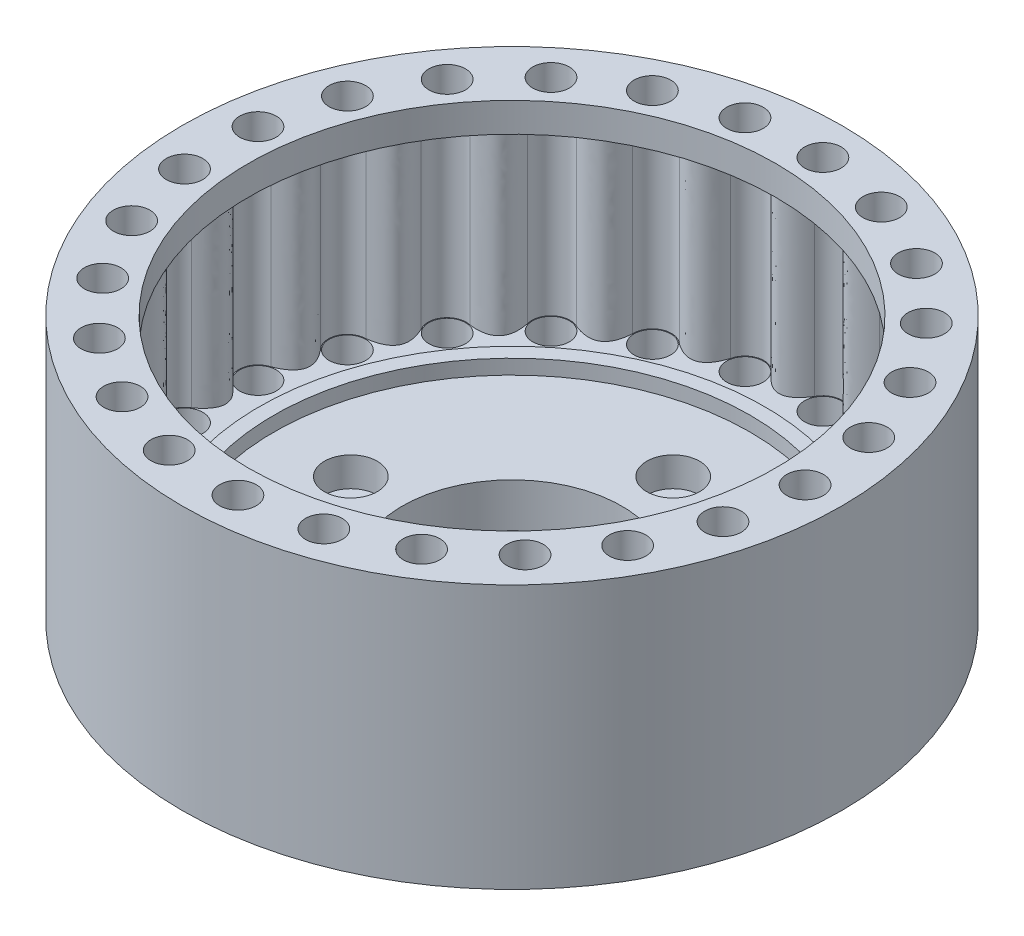
from build123d import *

# Parameters (mm, degrees)
SKETCH1_R           = 45
SKETCH1_R_2         = 2
BOSS_EXTRUDE1_DEPTH = 6
SKETCH2_R           = 3.61
CUT_EXTRUDE1_DEPTH  = 4
SKETCH4_R           = 15
CUT_EXTRUDE2_DEPTH  = 64.921827258
SKETCH5_R           = 2.5
CUT_EXTRUDE3_DEPTH  = 4
SKETCH6_R           = 34.5
SKETCH6_R_2         = 32.5
BOSS_EXTRUDE2_DEPTH = 2
SKETCH7_R           = 45
BOSS_EXTRUDE4_DEPTH = 30
BOSS_EXTRUDE5_START = -4
SKETCH8_R           = 45
SKETCH8_R_2         = 36
BOSS_EXTRUDE5_DEPTH = 4
SKETCH9_R           = 2.5
CUT_EXTRUDE4_DEPTH  = 4


with BuildPart() as part:
    # Sketch1 → Boss-Extrude1 (new body)
    with BuildSketch(Plane(origin=(0, 0, 0), x_dir=(1, 0, 0), z_dir=(0, 1, 0))):
        Circle(SKETCH1_R)
        with Locations((0, -22)):
            Circle(SKETCH1_R_2, mode=Mode.SUBTRACT)
        with Locations((-22, 0)):
            Circle(SKETCH1_R_2, mode=Mode.SUBTRACT)
        with Locations((0, 22)):
            Circle(SKETCH1_R_2, mode=Mode.SUBTRACT)
        with Locations((22, 0)):
            Circle(SKETCH1_R_2, mode=Mode.SUBTRACT)
    extrude(amount=BOSS_EXTRUDE1_DEPTH)

    # Sketch2 → Cut-Extrude1 (cut)
    with BuildSketch(Plane(origin=(0, 6, 0), x_dir=(1, 0, 0), z_dir=(0, 1, 0))):
        with Locations((0, 22)):
            Circle(SKETCH2_R)
        with Locations((22, 0)):
            Circle(SKETCH2_R)
        with Locations((0, -22)):
            Circle(SKETCH2_R)
        with Locations((-22, 0)):
            Circle(SKETCH2_R)
    extrude(amount=-CUT_EXTRUDE1_DEPTH, mode=Mode.SUBTRACT)

    # Sketch4 → Cut-Extrude2 (cut, through all)
    with BuildSketch(Plane(origin=(0, 6, 0), x_dir=(1, 0, 0), z_dir=(0, 1, 0))):
        Circle(SKETCH4_R)
    extrude(amount=-CUT_EXTRUDE2_DEPTH, mode=Mode.SUBTRACT)

    # Sketch5 → Cut-Extrude3 (cut)
    with BuildSketch(Plane(origin=(0, 6, 0), x_dir=(1, 0, 0), z_dir=(0, 1, 0))):
        with Locations((40, 0)):
            Circle(SKETCH5_R)
        with Locations((38.743326445, -9.947595487)):
            Circle(SKETCH5_R)
        with Locations((35.052267202, -19.270146964)):
            Circle(SKETCH5_R)
        with Locations((29.158745097, -27.381884237)):
            Circle(SKETCH5_R)
        with Locations((21.433071799, -33.77311702)):
            Circle(SKETCH5_R)
        with Locations((12.360679775, -38.042260652)):
            Circle(SKETCH5_R)
        with Locations((2.511620781, -39.921069137)):
            Circle(SKETCH5_R)
        with Locations((-7.495252583, -39.291490029)):
            Circle(SKETCH5_R)
        with Locations((-17.031171663, -36.193082099)):
            Circle(SKETCH5_R)
        with Locations((-25.49695959, -30.820529711)):
            Circle(SKETCH5_R)
        with Locations((-32.360679775, -23.511410092)):
            Circle(SKETCH5_R)
        with Locations((-37.191059436, -14.724982107)):
            Circle(SKETCH5_R)
        with Locations((-39.684588053, -5.013329343)):
            Circle(SKETCH5_R)
        with Locations((-39.684588053, 5.013329343)):
            Circle(SKETCH5_R)
        with Locations((-37.191059436, 14.724982107)):
            Circle(SKETCH5_R)
        with Locations((-32.360679775, 23.511410092)):
            Circle(SKETCH5_R)
        with Locations((-25.49695959, 30.820529711)):
            Circle(SKETCH5_R)
        with Locations((-17.031171663, 36.193082099)):
            Circle(SKETCH5_R)
        with Locations((-7.495252583, 39.291490029)):
            Circle(SKETCH5_R)
        with Locations((2.511620781, 39.921069137)):
            Circle(SKETCH5_R)
        with Locations((12.360679775, 38.042260652)):
            Circle(SKETCH5_R)
        with Locations((21.433071799, 33.77311702)):
            Circle(SKETCH5_R)
        with Locations((29.158745097, 27.381884237)):
            Circle(SKETCH5_R)
        with Locations((35.052267202, 19.270146964)):
            Circle(SKETCH5_R)
        with Locations((38.743326445, 9.947595487)):
            Circle(SKETCH5_R)
    extrude(amount=-CUT_EXTRUDE3_DEPTH, mode=Mode.SUBTRACT)

    # Sketch6 → Boss-Extrude2 (add)
    with BuildSketch(Plane(origin=(0, 6, 0), x_dir=(1, 0, 0), z_dir=(0, 1, 0))):
        Circle(SKETCH6_R)
        Circle(SKETCH6_R_2, mode=Mode.SUBTRACT)
    extrude(amount=BOSS_EXTRUDE2_DEPTH)

    # Sketch7 → Boss-Extrude4 (add)
    with BuildSketch(Plane(origin=(0, 6, 0), x_dir=(1, 0, 0), z_dir=(0, 1, 0))):
        Circle(SKETCH7_R)
        with BuildLine():
            ThreePointArc((34.786085666, -21.856485571), (37.33066457, -20.522706517), (37.093357913, -17.659572934))
            add(Edge.make_bspline(
                [(37.093357913, -17.659572934), (36.992833187, -17.498762481), (36.795597124, -17.160956609), (36.491730857, -16.541708189), (36.246669275, -15.818483644), (36.175890696, -15.051815417), (36.318726706, -14.379601147), (36.674766069, -13.791800055), (37.251181949, -13.281374242), (37.924905423, -12.921922435), (38.570319112, -12.678520537), (38.945342047, -12.567288031), (39.128703748, -12.518876166)],
                knots=[0.000576873, 0.000576873, 0.000576873, 0.000576873, 0.063004764, 0.125432655, 0.250288437, 0.375144218, 0.5, 0.624855782, 0.749711563, 0.874567345, 0.936995236, 0.999423127, 0.999423127, 0.999423127, 0.999423127], degree=3))
            ThreePointArc((39.128703748, -12.518876166), (41.261642664, -10.594189193), (40.319759065, -7.880021982))
            add(Edge.make_bspline(
                [(40.319759065, -7.880021982), (40.182400575, -7.749263168), (39.907352141, -7.471120704), (39.459031572, -6.946895579), (39.041810419, -6.3073368), (38.782592844, -5.582356783), (38.753768508, -4.895739488), (38.952442052, -4.237861859), (39.383811029, -3.600123211), (39.946976213, -3.084416029), (40.511581453, -2.688153193), (40.847159953, -2.487150849), (41.012721469, -2.394659731)],
                knots=[0.000576873, 0.000576873, 0.000576873, 0.000576873, 0.063004764, 0.125432655, 0.250288437, 0.375144218, 0.5, 0.624855782, 0.749711563, 0.874567345, 0.936995236, 0.999423127, 0.999423127, 0.999423127, 0.999423127], degree=3))
            ThreePointArc((41.012721469, -2.394659731), (42.6, 0), (41.012721469, 2.394659731))
            add(Edge.make_bspline(
                [(41.012721469, 2.394659731), (40.847159953, 2.487150849), (40.511581453, 2.688153193), (39.946976213, 3.084416029), (39.383811029, 3.600123211), (38.952442052, 4.237861859), (38.753768508, 4.895739488), (38.782592844, 5.582356783), (39.041810419, 6.3073368), (39.459031572, 6.946895579), (39.907352141, 7.471120704), (40.182400575, 7.749263168), (40.319759065, 7.880021982)],
                knots=[0.000576873, 0.000576873, 0.000576873, 0.000576873, 0.063004764, 0.125432655, 0.250288437, 0.375144218, 0.5, 0.624855782, 0.749711563, 0.874567345, 0.936995236, 0.999423127, 0.999423127, 0.999423127, 0.999423127], degree=3))
            ThreePointArc((40.319759065, 7.880021982), (41.261642664, 10.594189193), (39.128703748, 12.518876166))
            add(Edge.make_bspline(
                [(39.128703748, 12.518876166), (38.945342047, 12.567288031), (38.570319112, 12.678520537), (37.924905423, 12.921922435), (37.251181949, 13.281374242), (36.674766069, 13.791800055), (36.318726706, 14.379601147), (36.175890696, 15.051815417), (36.246669275, 15.818483644), (36.491730857, 16.541708189), (36.795597124, 17.160956609), (36.992833187, 17.498762481), (37.093357913, 17.659572934)],
                knots=[0.000576873, 0.000576873, 0.000576873, 0.000576873, 0.063004764, 0.125432655, 0.250288437, 0.375144218, 0.5, 0.624855782, 0.749711563, 0.874567345, 0.936995236, 0.999423127, 0.999423127, 0.999423127, 0.999423127], degree=3))
            ThreePointArc((37.093357913, 17.659572934), (37.33066457, 20.522706517), (34.786085666, 21.856485571))
            add(Edge.make_bspline(
                [(34.786085666, 21.856485571), (34.596445068, 21.857776287), (34.20554177, 21.872249808), (33.519873348, 21.94749693), (32.777924106, 22.128107683), (32.092679653, 22.479148731), (31.601645735, 22.959939581), (31.296124289, 23.575513133), (31.174016594, 24.335696984), (31.231520486, 25.097144438), (31.371839415, 25.772506497), (31.478870041, 26.148750191), (31.536244664, 26.32950797)],
                knots=[0.000576873, 0.000576873, 0.000576873, 0.000576873, 0.063004764, 0.125432655, 0.250288437, 0.375144218, 0.5, 0.624855782, 0.749711563, 0.874567345, 0.936995236, 0.999423127, 0.999423127, 0.999423127, 0.999423127], degree=3))
            ThreePointArc((31.536244664, 26.32950797), (31.054063528, 29.161706713), (28.257729887, 29.820771605))
            add(Edge.make_bspline(
                [(28.257729887, 29.820771605), (28.07372621, 29.774860072), (27.691504438, 29.691665184), (27.008664353, 29.594029476), (26.245108743, 29.584450736), (25.494092146, 29.754049819), (24.898917139, 30.097620571), (24.449907294, 30.617874654), (24.1425858, 31.323808983), (24.00891882, 32.0756348), (23.976873658, 32.764675018), (23.986973718, 33.155715758), (23.997593181, 33.345063188)],
                knots=[0.000576873, 0.000576873, 0.000576873, 0.000576873, 0.063004764, 0.125432655, 0.250288437, 0.375144218, 0.5, 0.624855782, 0.749711563, 0.874567345, 0.936995236, 0.999423127, 0.999423127, 0.999423127, 0.999423127], degree=3))
            ThreePointArc((23.997593181, 33.345063188), (22.826221466, 35.968369626), (19.953837015, 35.911308886))
            add(Edge.make_bspline(
                [(19.953837015, 35.911308886), (19.787031885, 35.821079894), (19.437508041, 35.645444037), (18.800401646, 35.381060311), (18.063216675, 35.181893946), (17.293617069, 35.159394529), (16.631698007, 35.344157369), (16.067412703, 35.736402505), (15.594187551, 36.343730862), (15.277748487, 37.038695063), (15.075352749, 37.698118507), (14.987887619, 38.079385766), (14.951084661, 38.265425451)],
                knots=[0.000576873, 0.000576873, 0.000576873, 0.000576873, 0.063004764, 0.125432655, 0.250288437, 0.375144218, 0.5, 0.624855782, 0.749711563, 0.874567345, 0.936995236, 0.999423127, 0.999423127, 0.999423127, 0.999423127], degree=3))
            ThreePointArc((14.951084661, 38.265425451), (13.16412396, 40.515007594), (10.396171178, 39.745406556))
            add(Edge.make_bspline(
                [(10.396171178, 39.745406556), (10.257045576, 39.616529525), (9.962181528, 39.359488547), (9.41084056, 38.944969004), (8.746346272, 38.56872937), (8.00652043, 38.355545174), (7.319448123, 38.369890772), (6.675343481, 38.609480758), (6.065949146, 39.080042468), (5.586621029, 39.674477895), (5.226591983, 40.262850566), (5.047057419, 40.61038792), (4.965144505, 40.781430303)],
                knots=[0.000576873, 0.000576873, 0.000576873, 0.000576873, 0.063004764, 0.125432655, 0.250288437, 0.375144218, 0.5, 0.624855782, 0.749711563, 0.874567345, 0.936995236, 0.999423127, 0.999423127, 0.999423127, 0.999423127], degree=3))
            ThreePointArc((4.965144505, 40.781430303), (2.674876132, 42.515938631), (0.185275671, 41.08215416))
            add(Edge.make_bspline(
                [(0.185275671, 41.08215416), (0.08257137, 40.922726908), (-0.13910549, 40.600431637), (-0.570038249, 40.061822065), (-1.120089235, 39.532149681), (-1.783655334, 39.141675854), (-2.452709606, 38.984702824), (-3.136162123, 39.056583339), (-3.843435152, 39.360811279), (-4.455534375, 39.817367369), (-4.95057478, 40.297719647), (-5.21089796, 40.589690046), (-5.33277394, 40.734987905)],
                knots=[0.000576873, 0.000576873, 0.000576873, 0.000576873, 0.063004764, 0.125432655, 0.250288437, 0.375144218, 0.5, 0.624855782, 0.749711563, 0.874567345, 0.936995236, 0.999423127, 0.999423127, 0.999423127, 0.999423127], degree=3))
            ThreePointArc((-5.33277394, 40.734987905), (-7.982444001, 41.845436881), (-10.037261387, 39.837558928))
            add(Edge.make_bspline(
                [(-10.037261387, 39.837558928), (-10.097091098, 39.657598855), (-10.231651998, 39.290300289), (-10.515099458, 38.661443509), (-10.916145416, 38.011619639), (-11.461757473, 37.468391087), (-12.07075457, 37.149962622), (-12.750611127, 37.049617149), (-13.511322285, 37.168395559), (-14.217732168, 37.458385213), (-14.816678722, 37.800534799), (-15.141433456, 38.018592668), (-15.295614586, 38.129016404)],
                knots=[0.000576873, 0.000576873, 0.000576873, 0.000576873, 0.063004764, 0.125432655, 0.250288437, 0.375144218, 0.5, 0.624855782, 0.749711563, 0.874567345, 0.936995236, 0.999423127, 0.999423127, 0.999423127, 0.999423127], degree=3))
            ThreePointArc((-15.295614586, 38.129016404), (-18.138197821, 38.545632435), (-19.629120398, 36.089823356))
            add(Edge.make_bspline(
                [(-19.629120398, 36.089823356), (-19.642316199, 35.900638016), (-19.681306181, 35.511414875), (-19.799458296, 34.83182427), (-20.026300033, 34.102679738), (-20.419675237, 33.440829508), (-20.930349631, 32.98095364), (-21.56389234, 32.714687254), (-22.330243348, 32.64055285), (-23.086577559, 32.745754952), (-23.751796248, 32.928203329), (-24.120577002, 33.058647291), (-24.297375514, 33.127258574)],
                knots=[0.000576873, 0.000576873, 0.000576873, 0.000576873, 0.063004764, 0.125432655, 0.250288437, 0.375144218, 0.5, 0.624855782, 0.749711563, 0.874567345, 0.936995236, 0.999423127, 0.999423127, 0.999423127, 0.999423127], degree=3))
            ThreePointArc((-24.297375514, 33.127258574), (-27.154261963, 32.823864142), (-27.987609584, 30.074431454))
            add(Edge.make_bspline(
                [(-27.987609584, 30.074431454), (-27.953342333, 29.887908057), (-27.894311514, 29.501216663), (-27.839744353, 28.813593409), (-27.878128568, 28.050943048), (-28.094549707, 27.312057625), (-28.474813849, 26.739630046), (-29.022234891, 26.324173243), (-29.746073096, 26.061784162), (-30.504808376, 25.975588477), (-31.194501062, 25.986871742), (-31.584135985, 26.021505523), (-31.77244298, 26.043993254)],
                knots=[0.000576873, 0.000576873, 0.000576873, 0.000576873, 0.063004764, 0.125432655, 0.250288437, 0.375144218, 0.5, 0.624855782, 0.749711563, 0.874567345, 0.936995236, 0.999423127, 0.999423127, 0.999423127, 0.999423127], degree=3))
            ThreePointArc((-31.77244298, 26.043993254), (-34.46412396, 25.039651748), (-34.587534328, 22.169352418))
            add(Edge.make_bspline(
                [(-34.587534328, 22.169352418), (-34.507957163, 21.997210914), (-34.354614667, 21.637348509), (-34.130756884, 20.984898506), (-33.978271756, 20.236662442), (-34.004140295, 19.467168715), (-34.230100789, 18.818157154), (-34.657003687, 18.279614614), (-35.292847673, 17.845457726), (-36.006309894, 17.573280246), (-36.67714065, 17.41268943), (-37.063147546, 17.349336862), (-37.251131002, 17.324288055)],
                knots=[0.000576873, 0.000576873, 0.000576873, 0.000576873, 0.063004764, 0.125432655, 0.250288437, 0.375144218, 0.5, 0.624855782, 0.749711563, 0.874567345, 0.936995236, 0.999423127, 0.999423127, 0.999423127, 0.999423127], degree=3))
            ThreePointArc((-37.251131002, 17.324288055), (-39.608478299, 15.682105944), (-39.014197086, 12.871291436))
            add(Edge.make_bspline(
                [(-39.014197086, 12.871291436), (-38.894310133, 12.72434811), (-38.656291033, 12.413926172), (-38.277208436, 11.837645253), (-37.943435166, 11.15083791), (-37.77712569, 10.399085999), (-37.834584607, 9.71427024), (-38.114145482, 9.086480571), (-38.622042832, 8.507835551), (-39.245402539, 8.066778187), (-39.855220601, 7.744403802), (-40.213345238, 7.58704556), (-40.389193463, 7.516034123)],
                knots=[0.000576873, 0.000576873, 0.000576873, 0.000576873, 0.063004764, 0.125432655, 0.250288437, 0.375144218, 0.5, 0.624855782, 0.749711563, 0.874567345, 0.936995236, 0.999423127, 0.999423127, 0.999423127, 0.999423127], degree=3))
            ThreePointArc((-40.389193463, 7.516034123), (-42.264086276, 5.33919575), (-40.989454357, 2.764479875))
            add(Edge.make_bspline(
                [(-40.989454357, 2.764479875), (-40.836790555, 2.651967717), (-40.529050465, 2.410491199), (-40.018562208, 1.946589212), (-39.524472999, 1.364365222), (-39.176435343, 0.677590465), (-39.061782329, 0), (-39.176435343, -0.677590465), (-39.524472999, -1.364365222), (-40.018562208, -1.946589212), (-40.529050465, -2.410491199), (-40.836790555, -2.651967717), (-40.989454357, -2.764479875)],
                knots=[0.000576873, 0.000576873, 0.000576873, 0.000576873, 0.063004764, 0.125432655, 0.250288437, 0.375144218, 0.5, 0.624855782, 0.749711563, 0.874567345, 0.936995236, 0.999423127, 0.999423127, 0.999423127, 0.999423127], degree=3))
            ThreePointArc((-40.989454357, -2.764479875), (-42.264086276, -5.33919575), (-40.389193463, -7.516034123))
            add(Edge.make_bspline(
                [(-40.389193463, -7.516034123), (-40.213345238, -7.58704556), (-39.855220601, -7.744403802), (-39.245402539, -8.066778187), (-38.622042832, -8.507835551), (-38.114145482, -9.086480571), (-37.834584607, -9.71427024), (-37.77712569, -10.399085999), (-37.943435166, -11.15083791), (-38.277208436, -11.837645253), (-38.656291033, -12.413926172), (-38.894310133, -12.72434811), (-39.014197086, -12.871291436)],
                knots=[0.000576873, 0.000576873, 0.000576873, 0.000576873, 0.063004764, 0.125432655, 0.250288437, 0.375144218, 0.5, 0.624855782, 0.749711563, 0.874567345, 0.936995236, 0.999423127, 0.999423127, 0.999423127, 0.999423127], degree=3))
            ThreePointArc((-39.014197086, -12.871291436), (-39.608478299, -15.682105944), (-37.251131002, -17.324288055))
            add(Edge.make_bspline(
                [(-37.251131002, -17.324288055), (-37.063147546, -17.349336862), (-36.67714065, -17.41268943), (-36.006309894, -17.573280246), (-35.292847673, -17.845457726), (-34.657003687, -18.279614614), (-34.230100789, -18.818157154), (-34.004140295, -19.467168715), (-33.978271756, -20.236662442), (-34.130756884, -20.984898506), (-34.354614667, -21.637348509), (-34.507957163, -21.997210914), (-34.587534328, -22.169352418)],
                knots=[0.000576873, 0.000576873, 0.000576873, 0.000576873, 0.063004764, 0.125432655, 0.250288437, 0.375144218, 0.5, 0.624855782, 0.749711563, 0.874567345, 0.936995236, 0.999423127, 0.999423127, 0.999423127, 0.999423127], degree=3))
            ThreePointArc((-34.587534328, -22.169352418), (-34.46412396, -25.039651748), (-31.77244298, -26.043993254))
            add(Edge.make_bspline(
                [(-31.77244298, -26.043993254), (-31.584135985, -26.021505523), (-31.194501062, -25.986871742), (-30.504808376, -25.975588477), (-29.746073096, -26.061784162), (-29.022234891, -26.324173243), (-28.474813849, -26.739630046), (-28.094549707, -27.312057625), (-27.878128568, -28.050943048), (-27.839744353, -28.813593409), (-27.894311514, -29.501216663), (-27.953342333, -29.887908057), (-27.987609584, -30.074431454)],
                knots=[0.000576873, 0.000576873, 0.000576873, 0.000576873, 0.063004764, 0.125432655, 0.250288437, 0.375144218, 0.5, 0.624855782, 0.749711563, 0.874567345, 0.936995236, 0.999423127, 0.999423127, 0.999423127, 0.999423127], degree=3))
            ThreePointArc((-27.987609584, -30.074431454), (-27.154261963, -32.823864142), (-24.297375514, -33.127258574))
            add(Edge.make_bspline(
                [(-24.297375514, -33.127258574), (-24.120577002, -33.058647291), (-23.751796248, -32.928203329), (-23.086577559, -32.745754952), (-22.330243348, -32.64055285), (-21.56389234, -32.714687254), (-20.930349631, -32.98095364), (-20.419675237, -33.440829508), (-20.026300033, -34.102679738), (-19.799458296, -34.83182427), (-19.681306181, -35.511414875), (-19.642316199, -35.900638016), (-19.629120398, -36.089823356)],
                knots=[0.000576873, 0.000576873, 0.000576873, 0.000576873, 0.063004764, 0.125432655, 0.250288437, 0.375144218, 0.5, 0.624855782, 0.749711563, 0.874567345, 0.936995236, 0.999423127, 0.999423127, 0.999423127, 0.999423127], degree=3))
            ThreePointArc((-19.629120398, -36.089823356), (-18.138197821, -38.545632435), (-15.295614586, -38.129016404))
            add(Edge.make_bspline(
                [(-15.295614586, -38.129016404), (-15.141433456, -38.018592668), (-14.816678722, -37.800534799), (-14.217732168, -37.458385213), (-13.511322285, -37.168395559), (-12.750611127, -37.049617149), (-12.07075457, -37.149962622), (-11.461757473, -37.468391087), (-10.916145416, -38.011619639), (-10.515099458, -38.661443509), (-10.231651998, -39.290300289), (-10.097091098, -39.657598855), (-10.037261387, -39.837558928)],
                knots=[0.000576873, 0.000576873, 0.000576873, 0.000576873, 0.063004764, 0.125432655, 0.250288437, 0.375144218, 0.5, 0.624855782, 0.749711563, 0.874567345, 0.936995236, 0.999423127, 0.999423127, 0.999423127, 0.999423127], degree=3))
            ThreePointArc((-10.037261387, -39.837558928), (-7.982444001, -41.845436881), (-5.33277394, -40.734987905))
            add(Edge.make_bspline(
                [(-5.33277394, -40.734987905), (-5.21089796, -40.589690046), (-4.95057478, -40.297719647), (-4.455534375, -39.817367369), (-3.843435152, -39.360811279), (-3.136162123, -39.056583339), (-2.452709606, -38.984702824), (-1.783655334, -39.141675854), (-1.120089235, -39.532149681), (-0.570038249, -40.061822065), (-0.13910549, -40.600431637), (0.08257137, -40.922726908), (0.185275671, -41.08215416)],
                knots=[0.000576873, 0.000576873, 0.000576873, 0.000576873, 0.063004764, 0.125432655, 0.250288437, 0.375144218, 0.5, 0.624855782, 0.749711563, 0.874567345, 0.936995236, 0.999423127, 0.999423127, 0.999423127, 0.999423127], degree=3))
            ThreePointArc((0.185275671, -41.08215416), (2.674876132, -42.515938631), (4.965144505, -40.781430303))
            add(Edge.make_bspline(
                [(4.965144505, -40.781430303), (5.047057419, -40.61038792), (5.226591983, -40.262850566), (5.586621029, -39.674477895), (6.065949146, -39.080042468), (6.675343481, -38.609480758), (7.319448123, -38.369890772), (8.00652043, -38.355545174), (8.746346272, -38.56872937), (9.41084056, -38.944969004), (9.962181528, -39.359488547), (10.257045576, -39.616529525), (10.396171178, -39.745406556)],
                knots=[0.000576873, 0.000576873, 0.000576873, 0.000576873, 0.063004764, 0.125432655, 0.250288437, 0.375144218, 0.5, 0.624855782, 0.749711563, 0.874567345, 0.936995236, 0.999423127, 0.999423127, 0.999423127, 0.999423127], degree=3))
            ThreePointArc((10.396171178, -39.745406556), (13.16412396, -40.515007594), (14.951084661, -38.265425451))
            add(Edge.make_bspline(
                [(14.951084661, -38.265425451), (14.987887619, -38.079385766), (15.075352749, -37.698118507), (15.277748487, -37.038695063), (15.594187551, -36.343730862), (16.067412703, -35.736402505), (16.631698007, -35.344157369), (17.293617069, -35.159394529), (18.063216675, -35.181893946), (18.800401646, -35.381060311), (19.437508041, -35.645444037), (19.787031885, -35.821079894), (19.953837015, -35.911308886)],
                knots=[0.000576873, 0.000576873, 0.000576873, 0.000576873, 0.063004764, 0.125432655, 0.250288437, 0.375144218, 0.5, 0.624855782, 0.749711563, 0.874567345, 0.936995236, 0.999423127, 0.999423127, 0.999423127, 0.999423127], degree=3))
            ThreePointArc((19.953837015, -35.911308886), (22.826221466, -35.968369626), (23.997593181, -33.345063188))
            add(Edge.make_bspline(
                [(23.997593181, -33.345063188), (23.986973718, -33.155715758), (23.976873658, -32.764675018), (24.00891882, -32.0756348), (24.1425858, -31.323808983), (24.449907294, -30.617874654), (24.898917139, -30.097620571), (25.494092146, -29.754049819), (26.245108743, -29.584450736), (27.008664353, -29.594029476), (27.691504438, -29.691665184), (28.07372621, -29.774860072), (28.257729887, -29.820771605)],
                knots=[0.000576873, 0.000576873, 0.000576873, 0.000576873, 0.063004764, 0.125432655, 0.250288437, 0.375144218, 0.5, 0.624855782, 0.749711563, 0.874567345, 0.936995236, 0.999423127, 0.999423127, 0.999423127, 0.999423127], degree=3))
            ThreePointArc((28.257729887, -29.820771605), (31.054063528, -29.161706713), (31.536244664, -26.32950797))
            add(Edge.make_bspline(
                [(31.536244664, -26.32950797), (31.478870041, -26.148750191), (31.371839415, -25.772506497), (31.231520486, -25.097144438), (31.174016594, -24.335696984), (31.296124289, -23.575513133), (31.601645735, -22.959939581), (32.092679653, -22.479148731), (32.777924106, -22.128107683), (33.519873348, -21.94749693), (34.20554177, -21.872249808), (34.596445068, -21.857776287), (34.786085666, -21.856485571)],
                knots=[0.000576873, 0.000576873, 0.000576873, 0.000576873, 0.063004764, 0.125432655, 0.250288437, 0.375144218, 0.5, 0.624855782, 0.749711563, 0.874567345, 0.936995236, 0.999423127, 0.999423127, 0.999423127, 0.999423127], degree=3))
        make_face(mode=Mode.SUBTRACT)
    extrude(amount=BOSS_EXTRUDE4_DEPTH)

    # Sketch8 → Boss-Extrude5 (add)
    with BuildSketch(Plane(origin=(0, 36, 0), x_dir=(1, 0, 0), z_dir=(0, 1, 0)).offset(BOSS_EXTRUDE5_START)):
        Circle(SKETCH8_R)
        Circle(SKETCH8_R_2, mode=Mode.SUBTRACT)
    extrude(amount=BOSS_EXTRUDE5_DEPTH)

    # Sketch9 → Cut-Extrude4 (cut)
    with BuildSketch(Plane(origin=(0, 36, 0), x_dir=(1, 0, 0), z_dir=(0, 1, 0))):
        with Locations((-17.031171663, 36.193082099)):
            Circle(SKETCH9_R)
        with Locations((-7.495252583, 39.291490029)):
            Circle(SKETCH9_R)
        with Locations((12.360679775, 38.042260652)):
            Circle(SKETCH9_R)
        with Locations((21.433071799, 33.77311702)):
            Circle(SKETCH9_R)
        with Locations((29.158745097, 27.381884237)):
            Circle(SKETCH9_R)
        with Locations((35.052267202, 19.270146964)):
            Circle(SKETCH9_R)
        with Locations((38.743326445, 9.947595487)):
            Circle(SKETCH9_R)
        with Locations((40, 0)):
            Circle(SKETCH9_R)
        with Locations((38.743326445, -9.947595487)):
            Circle(SKETCH9_R)
        with Locations((35.052267202, -19.270146964)):
            Circle(SKETCH9_R)
        with Locations((29.158745097, -27.381884237)):
            Circle(SKETCH9_R)
        with Locations((-7.495252583, -39.291490029)):
            Circle(SKETCH9_R)
        with Locations((12.360679775, -38.042260652)):
            Circle(SKETCH9_R)
        with Locations((2.511620781, 39.921069137)):
            Circle(SKETCH9_R)
        with Locations((-25.49695959, 30.820529711)):
            Circle(SKETCH9_R)
        with Locations((-32.360679775, 23.511410092)):
            Circle(SKETCH9_R)
        with Locations((-37.191059436, 14.724982107)):
            Circle(SKETCH9_R)
        with Locations((-39.684588053, 5.013329343)):
            Circle(SKETCH9_R)
        with Locations((-39.684588053, -5.013329343)):
            Circle(SKETCH9_R)
        with Locations((-37.191059436, -14.724982107)):
            Circle(SKETCH9_R)
        with Locations((-32.360679775, -23.511410092)):
            Circle(SKETCH9_R)
        with Locations((-25.49695959, -30.820529711)):
            Circle(SKETCH9_R)
        with Locations((-17.031171663, -36.193082099)):
            Circle(SKETCH9_R)
        with Locations((2.511620781, -39.921069137)):
            Circle(SKETCH9_R)
        with Locations((21.433071799, -33.77311702)):
            Circle(SKETCH9_R)
    extrude(amount=-CUT_EXTRUDE4_DEPTH, mode=Mode.SUBTRACT)


solid = part.part
